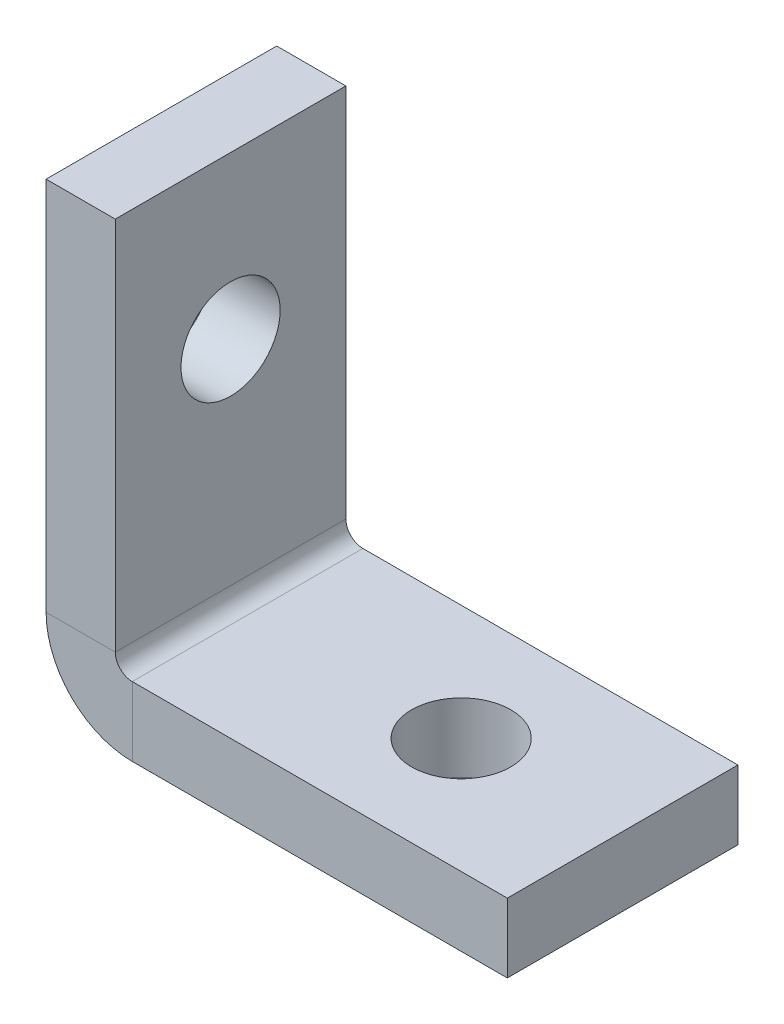
from build123d import *

# Parameters (mm, degrees)
SM_BASE_FLANGE_2_DEPTH  = 10
HOLE_WIZARD_4_3_4_3_1_D = 4.3
HOLE_WIZARD_4_3_4_3_2_D = 4.3


# Sheet-metal steps are written as plain solids
with BuildPart() as part:
    # 草图18 → 基体-法兰2 (new body)
    with BuildSketch(Plane.XY):
        with BuildLine():
            Line((0, 20), (0, 3.7366))
            ThreePointArc((0, 3.7366), (1.094424801, 1.094424801), (3.7366, 0))
            Line((3.7366, 0), (20, 0))
            Line((20, 0), (20, 3))
            Line((20, 3), (3.7366, 3))
            ThreePointArc((3.7366, 3), (3.215745145, 3.215745145), (3, 3.7366))
            Line((3, 3.7366), (3, 20))
            Line((3, 20), (0, 20))
        make_face()
    extrude(amount=SM_BASE_FLANGE_2_DEPTH)

    # Ø4.3 (4.3) 直径孔1 (through all)
    with Locations(Plane.ZY):
        with Locations((5, 13)):
            Hole(HOLE_WIZARD_4_3_4_3_1_D / 2)

    # Ø4.3 (4.3) 直径孔2 (through all)
    with Locations(Plane(origin=(0, 0, 0), x_dir=(-1, 0, 0), z_dir=(0, -1, 0))):
        with Locations((-13, -5)):
            Hole(HOLE_WIZARD_4_3_4_3_2_D / 2)


solid = part.part
